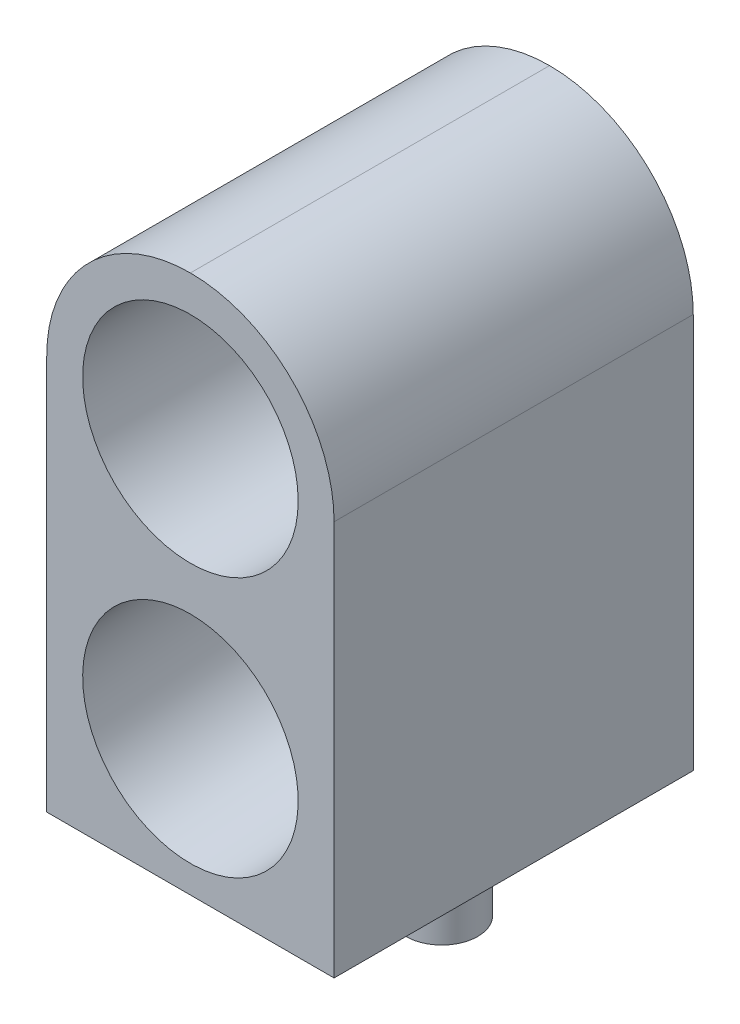
from build123d import *

# Parameters (mm, degrees)
SZKIC1_W                    = 8
SZKIC1_H                    = 15
DODANIE_WYCI_GNI_CIE1_DEPTH = 10
ZAOKR_GLENIE1_R             = 4
SZKIC2_R                    = 1
DODANIE_WYCI_GNI_CIE2_DEPTH = 2
SZKIC4_R                    = 3
WYTNIJ_WYCI_GNI_CIE1_DEPTH  = 15
SZKIC9_R                    = 3
WYTNIJ_WYCI_GNI_CIE2_DEPTH  = 25


with BuildPart() as part:
    # Szkic1 → Dodanie-wyciągnięcie1 (new body)
    with BuildSketch(Plane.XY):
        Rectangle(SZKIC1_W, SZKIC1_H)
    extrude(amount=DODANIE_WYCI_GNI_CIE1_DEPTH)

    # Zaokrąglenie1
    zaokr_glenie1_edges = [part.edges().sort_by_distance(p)[0] for p in [
        (4, 7.5, 5),
        (-4, 7.5, 5),
    ]]
    fillet(zaokr_glenie1_edges, radius=ZAOKR_GLENIE1_R - 0.0001)  # a hair under: the kernel refuses the full size

    # Szkic2 → Dodanie-wyciągnięcie2 (add)
    with BuildSketch(Plane.XZ.offset(7.5)):
        with Locations(Location((-2, 5, 0), (0, 0, 90))):
            Circle(SZKIC2_R)
        with Locations(Location((2, 5, 0), (0, 0, 90))):
            Circle(SZKIC2_R)
    extrude(amount=DODANIE_WYCI_GNI_CIE2_DEPTH)

    # Szkic4 → Wytnij-wyciągnięcie1 (cut)
    with BuildSketch(Plane.XY.offset(10)):
        with Locations((0, 3.5)):
            Circle(SZKIC4_R)
    extrude(amount=-WYTNIJ_WYCI_GNI_CIE1_DEPTH, mode=Mode.SUBTRACT)

    # Szkic9 → Wytnij-wyciągnięcie2 (cut)
    with BuildSketch(Plane(origin=(0, -2.657422367, -5.349421519), x_dir=(1, 0, 0), z_dir=(0, -0.06975647374412577, 0.9975640502598243))):
        with Locations(Location((0, 0, 0), (0, 0, 90))):
            Circle(SZKIC9_R)
    extrude(amount=WYTNIJ_WYCI_GNI_CIE2_DEPTH, mode=Mode.SUBTRACT)


solid = part.part
